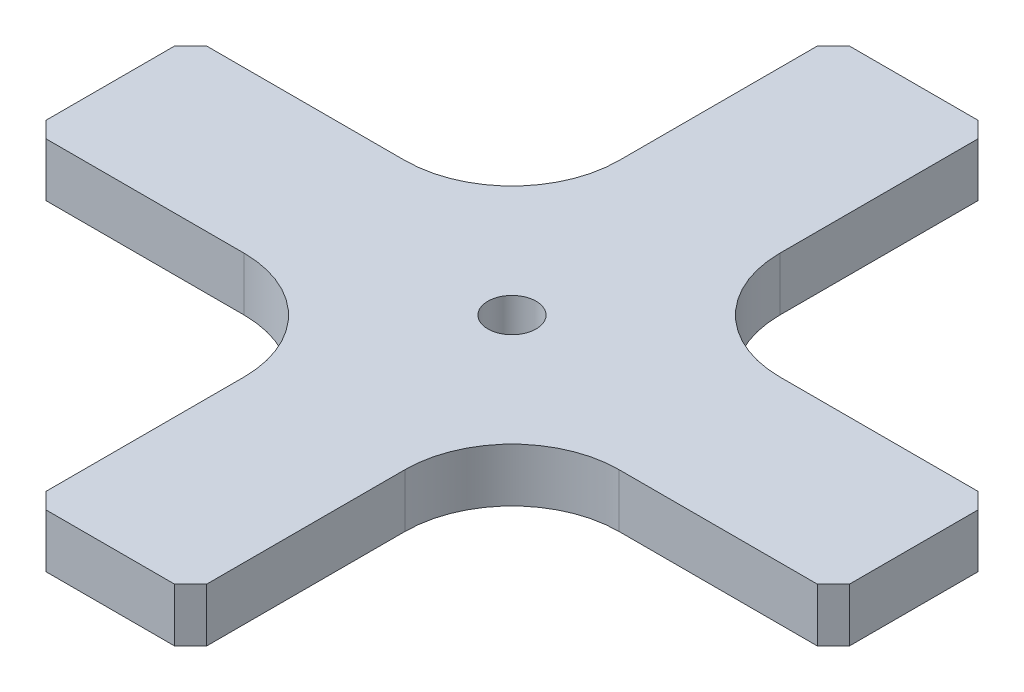
from build123d import *

# Parameters (mm, degrees)
BOSS_EXTRUDE1_DEPTH      = 2.5
FILLET1_R                = 10
CHAMFER1_SIZE            = 1.5
M4_CLEARANCE_HOLE1_D     = 4.5
M4_CLEARANCE_HOLE1_DEPTH = 5.2
M4_CLEARANCE_HOLE1_TIP   = 1.351936393


with BuildPart() as part:
    # Sketch2 → Boss-Extrude1 (new, symmetric)
    with BuildSketch(Plane(origin=(0, 0, 0), x_dir=(1, 0, 0), z_dir=(0, 1, 0))):
        Polygon((-7.5, 37.5), (7.5, 37.5), (7.5, 7.5), (37.5, 7.5), (37.5, -7.5), (7.5, -7.5), (7.5, -37.5), (-7.5, -37.5), (-7.5, -7.5), (-37.5, -7.5), (-37.5, 7.5), (-7.5, 7.5), align=None)
    extrude(amount=BOSS_EXTRUDE1_DEPTH, both=True)

    # Fillet1
    fillet1_edges = [part.edges().sort_by_distance(p)[0] for p in [
        (-7.5, 0, -7.5),
        (7.5, 0, -7.5),
        (7.5, 0, 7.5),
        (-7.5, 0, 7.5),
    ]]
    fillet(fillet1_edges, radius=FILLET1_R)

    # Chamfer1
    chamfer1_edges = [part.edges().sort_by_distance(p)[0] for p in [
        (-37.5, 0, 7.5),
        (-37.5, 0, -7.5),
        (-7.5, 0, -37.5),
        (7.5, 0, -37.5),
        (37.5, 0, -7.5),
        (37.5, 0, 7.5),
        (7.5, 0, 37.5),
        (-7.5, 0, 37.5),
    ]]
    chamfer(chamfer1_edges, length=CHAMFER1_SIZE)

    # M4 Clearance Hole1
    with Locations(Plane(origin=(0, 2.5, 0), x_dir=(1, 0, 0), z_dir=(0, 1, 0))):
        with Locations((0, 0)):
            Hole(M4_CLEARANCE_HOLE1_D / 2, depth=M4_CLEARANCE_HOLE1_DEPTH)
            with Locations((0, 0, -(M4_CLEARANCE_HOLE1_DEPTH + M4_CLEARANCE_HOLE1_TIP / 2))):  # 118° drill point
                Cone(0, M4_CLEARANCE_HOLE1_D / 2, M4_CLEARANCE_HOLE1_TIP, mode=Mode.SUBTRACT)


solid = part.part
